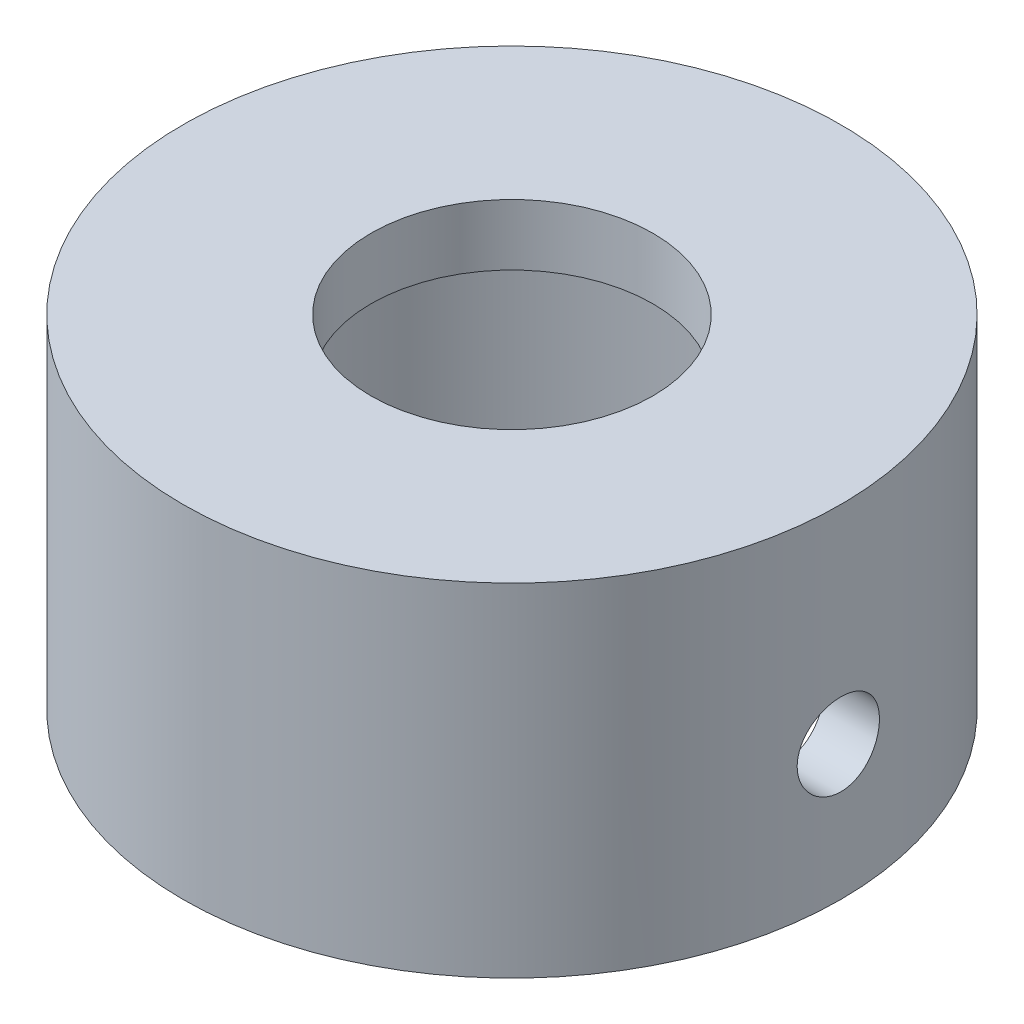
from build123d import *

# Parameters (mm, degrees)
SKETCH1_R               = 22.225
BOSS_EXTRUDE1_DEPTH     = 19.05
SKETCH2_R               = 18.542
CUT_EXTRUDE1_DEPTH      = 13.3985
SKETCH3_R               = 9.525
CUT_EXTRUDE2_DEPTH      = 37.753282166
SKETCH4_R               = 15.875
CUT_EXTRUDE3_DEPTH      = 1.524
CUT_EXTRUDE4_DEPTH      = 37.753282166
CUT_EXTRUDE4_DEPTH_BACK = 37.753282166
SKETCH5_R               = 2.778125
SKETCH6_R               = 22.225
BOSS_EXTRUDE2_DEPTH     = 4.064
SKETCH7_R               = 18.542
CUT_EXTRUDE5_DEPTH      = 6.35


with BuildPart() as part:
    # Sketch1 → Boss-Extrude1 (new body)
    with BuildSketch(Plane(origin=(0, 0, 0), x_dir=(1, 0, 0), z_dir=(0, 1, 0))):
        Circle(SKETCH1_R)
    extrude(amount=-BOSS_EXTRUDE1_DEPTH)

    # Sketch2 → Cut-Extrude1 (cut)
    with BuildSketch(Plane.XZ.offset(19.05)):
        Circle(SKETCH2_R)
    extrude(amount=-CUT_EXTRUDE1_DEPTH, mode=Mode.SUBTRACT)

    # Sketch3 → Cut-Extrude2 (cut, through all)
    with BuildSketch(Plane(origin=(0, 0, 0), x_dir=(1, 0, 0), z_dir=(0, 1, 0))):
        Circle(SKETCH3_R)
    extrude(amount=-CUT_EXTRUDE2_DEPTH, mode=Mode.SUBTRACT)

    # Sketch4 → Cut-Extrude3 (cut)
    with BuildSketch(Plane.XZ.offset(5.6515)):
        Circle(SKETCH4_R)
    extrude(amount=-CUT_EXTRUDE3_DEPTH, mode=Mode.SUBTRACT)

    # Sketch5 → Cut-Extrude4 (cut, two sides: drawn at the far end of the back side and taken through both)
    with BuildSketch(Plane(origin=(0, 0, 0), x_dir=(0, 0, -1), z_dir=(1, 0, 0)).offset(-CUT_EXTRUDE4_DEPTH_BACK)):
        with Locations((0, -14.0335)):
            Circle(SKETCH5_R)
    extrude(amount=CUT_EXTRUDE4_DEPTH + CUT_EXTRUDE4_DEPTH_BACK, mode=Mode.SUBTRACT)

    # Sketch6 → Boss-Extrude2 (add)
    with BuildSketch(Plane.XZ.offset(19.05)):
        Circle(SKETCH6_R)
    extrude(amount=BOSS_EXTRUDE2_DEPTH)

    # Sketch7 → Cut-Extrude5 (cut)
    with BuildSketch(Plane.XZ.offset(23.114)):
        Circle(SKETCH7_R)
    extrude(amount=-CUT_EXTRUDE5_DEPTH, mode=Mode.SUBTRACT)


solid = part.part
